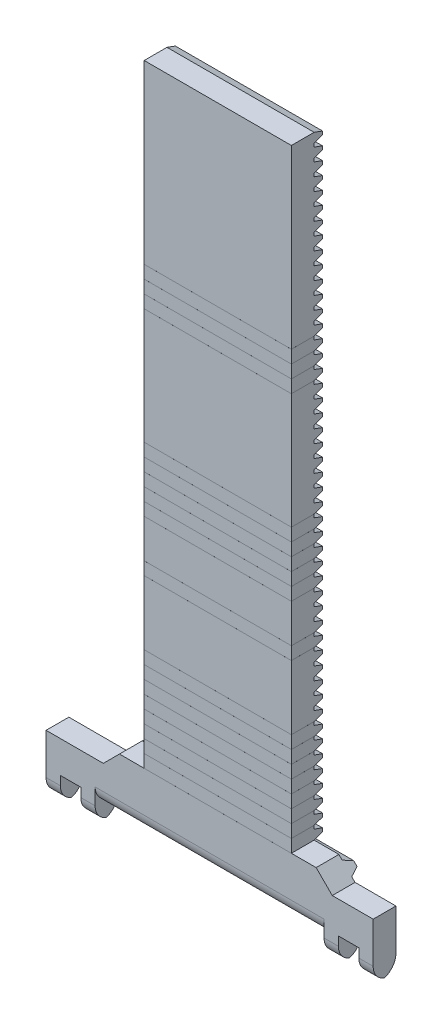
from build123d import *

# Parameters (mm, degrees)
BOSS_EXTRUDE1_DEPTH = 36
SCALE2_SCALE        = 0.5
SKETCH2_W           = 18
SKETCH2_H           = 20.0171228
BOSS_EXTRUDE2_DEPTH = 2
BOSS_EXTRUDE3_DEPTH = 18
SKETCH4_W           = 13.36957342
SKETCH4_H           = 20.007555445
CUT_EXTRUDE1_DEPTH  = 20
BOSS_EXTRUDE4_DEPTH = 5
CHAMFER1_SIZE       = 5
SKETCH6_W           = 6
SKETCH6_H           = 2.78539815
BOSS_EXTRUDE5_DEPTH = 2
FILLET2_R           = 2
SKETCH7_W           = 2.5
SKETCH7_H           = 3
CUT_EXTRUDE2_DEPTH  = 83.676186003


with BuildPart() as part:
    # Sketch1 → Boss-Extrude1 (new body)
    with BuildSketch(Plane(origin=(0, 0, 0), x_dir=(0, 0, -1), z_dir=(1, 0, 0))):
        Polygon((-1.05, -20.0171228), (1, -19.2709839), (1, -18.428128), (-1.05, -17.681989), (-1.05, -16.8755302), (1, -16.1293912), (1, -15.2865353), (-1.05, -14.5403964), (-1.05, -13.7339375), (1, -12.9877985), (1, -12.1449427), (-1.05, -11.3988037), (-1.05, -10.5923449), (1, -9.8462059), (1, -9.00335), (-1.05, -8.2572111), (-1.05, -7.4507522), (1, -6.7046132), (1, -5.8617574), (-1.05, -5.1156184), (-1.05, -4.3091596), (1, -3.5630206), (1, -2.7201647), (-1.05, -1.9740257), (-1.05, -1.1675669), (1, -0.4214279), (1, 0.4214279), (-1.05, 1.1675669), (-1.05, 1.9740257), (1, 2.7201647), (1, 3.5630206), (-1.05, 4.3091596), (-1.05, 5.1156184), (1, 5.8617574), (1, 6.7046132), (-1.05, 7.4507522), (-1.05, 8.2572111), (1, 9.00335), (1, 9.8462059), (-1.05, 10.5923449), (-1.05, 11.3988037), (1, 12.1449427), (1, 12.9877985), (-1.05, 13.7339375), (-1.05, 14.5403964), (1, 15.2865353), (1, 16.1293912), (-1.05, 16.8755302), (-1.05, 17.681989), (1, 18.428128), (1, 19.2709839), (-1.05, 20.0171228), (-2.6207963, 20.0171228), (-2.6207963, -20.0171228), align=None)
    extrude(amount=BOSS_EXTRUDE1_DEPTH)


with BuildPart() as part_1:
    # Scale2: scaled about (18, 0, 1.171434086)
    add(part.part.scale(SCALE2_SCALE).moved(Location((9, 0, 0.585717043))))

    # Sketch2 → Boss-Extrude2 (add)
    with BuildSketch(Plane.XY.offset(1.896115193)):
        with Locations((18, 0)):
            Rectangle(SKETCH2_W, SKETCH2_H)
    extrude(amount=BOSS_EXTRUDE2_DEPTH)

    # Sketch3 → Boss-Extrude3 (add)
    with BuildSketch(Plane.ZY.offset(-9)):
        Polygon((3.896115193, -11.577763191), (3.896115193, -10.0085614), (1.110717043, -10.0085614), (1.110717043, -10.410993545), (0.085717043, -10.784063045), (0.085717043, -11.205490995), (1.110717043, -11.578560445), (1.110717043, -11.577763191), align=None)
        Polygon((3.896115193, -13.147762236), (3.896115193, -11.578560445), (1.110717043, -11.578560445), (1.110717043, -11.980992591), (0.085717043, -12.354062091), (0.085717043, -12.775490041), (1.110717043, -13.148559491), (1.110717043, -13.147762236), align=None)
        Polygon((3.896115193, -14.717761281), (3.896115193, -13.148559491), (1.110717043, -13.148559491), (1.110717043, -13.550991636), (0.085717043, -13.924061136), (0.085717043, -14.345489086), (1.110717043, -14.718558536), (1.110717043, -14.717761281), align=None)
        Polygon((3.896115193, -16.287760327), (3.896115193, -14.718558536), (1.110717043, -14.718558536), (1.110717043, -15.120990681), (0.085717043, -15.494060181), (0.085717043, -15.915488131), (1.110717043, -16.288557581), (1.110717043, -16.287760327), align=None)
        Polygon((3.896115193, -16.288557581), (1.110717043, -16.288557581), (1.110717043, -16.690989727), (0.085717043, -17.064059227), (0.085717043, -17.485487177), (1.110717043, -17.858556627), (1.110717043, -18.260988772), (0.085717043, -18.634058272), (0.085717043, -19.055486222), (1.110717043, -19.428555672), (1.110717043, -19.830987818), (0.085717043, -20.204057318), (0.085717043, -20.625485268), (1.110717043, -20.998554718), (1.110717043, -21.400986863), (0.085717043, -21.774056363), (0.085717043, -22.195484313), (1.110717043, -22.568553763), (1.110717043, -22.970985908), (0.085717043, -23.344055408), (0.085717043, -23.765483358), (1.110717043, -24.138552808), (1.110717043, -24.540984954), (0.085717043, -24.914054454), (0.085717043, -25.335482404), (1.110717043, -25.708551854), (1.110717043, -26.110983999), (0.085717043, -26.484053499), (0.085717043, -26.905481449), (1.110717043, -27.278550899), (1.110717043, -27.680983044), (0.085717043, -28.054052544), (0.085717043, -28.475480494), (1.110717043, -28.848549944), (1.110717043, -29.25098209), (0.085717043, -29.62405159), (0.085717043, -30.04547954), (1.110717043, -30.41854899), (1.110717043, -30.417751735), (3.896115193, -30.417751735), align=None)
        Polygon((3.896115193, -31.98775078), (3.896115193, -30.41854899), (1.110717043, -30.41854899), (1.110717043, -30.820981135), (0.085717043, -31.194050635), (0.085717043, -31.615478585), (1.110717043, -31.988548035), (1.110717043, -31.98775078), align=None)
        Polygon((3.896115193, -33.557749826), (3.896115193, -31.988548035), (1.110717043, -31.988548035), (1.110717043, -32.39098018), (0.085717043, -32.76404968), (0.085717043, -33.18547763), (1.110717043, -33.55854708), (1.110717043, -33.557749826), align=None)
        Polygon((3.896115193, -35.127748871), (3.896115193, -33.55854708), (1.110717043, -33.55854708), (1.110717043, -33.960979226), (0.085717043, -34.334048726), (0.085717043, -34.755476676), (1.110717043, -35.128546126), (1.110717043, -35.127748871), align=None)
        Polygon((3.896115193, -36.697747916), (3.896115193, -35.128546126), (1.110717043, -35.128546126), (1.110717043, -35.530978271), (0.085717043, -35.904047771), (0.085717043, -36.325475721), (1.110717043, -36.698545171), (1.110717043, -36.697747916), align=None)
        Polygon((3.896115193, -38.267746962), (3.896115193, -36.698545171), (1.110717043, -36.698545171), (1.110717043, -37.100977316), (0.085717043, -37.474046816), (0.085717043, -37.895474766), (1.110717043, -38.268544216), (1.110717043, -38.267746962), align=None)
        Polygon((3.896115193, -38.268544216), (1.110717043, -38.268544216), (1.110717043, -38.670976362), (0.085717043, -39.044045862), (0.085717043, -39.465473812), (1.110717043, -39.838543262), (1.110717043, -40.240975407), (0.085717043, -40.614044907), (0.085717043, -41.035472857), (1.110717043, -41.408542307), (1.110717043, -41.810974453), (0.085717043, -42.184043953), (0.085717043, -42.605471903), (1.110717043, -42.978541353), (1.110717043, -42.977744098), (3.896115193, -42.977744098), align=None)
        Polygon((3.896115193, -44.547743143), (3.896115193, -42.978541353), (1.110717043, -42.978541353), (1.110717043, -43.380973498), (0.085717043, -43.754042998), (0.085717043, -44.175470948), (1.110717043, -44.548540398), (1.110717043, -44.547743143), align=None)
        Polygon((3.896115193, -44.548540398), (1.110717043, -44.548540398), (1.110717043, -44.950972543), (0.085717043, -45.324042043), (0.085717043, -45.745469993), (1.110717043, -46.118539443), (1.110717043, -46.520971589), (0.085717043, -46.894041089), (0.085717043, -47.315469039), (1.110717043, -47.688538489), (1.110717043, -48.090970634), (0.085717043, -48.464040134), (0.085717043, -48.885468084), (1.110717043, -49.258537534), (1.110717043, -49.660969679), (0.085717043, -50.034039179), (0.085717043, -50.455467129), (1.110717043, -50.828536579), (1.110717043, -51.230968725), (0.085717043, -51.604038225), (0.085717043, -52.025466175), (1.110717043, -52.398535625), (1.110717043, -52.39773837), (3.896115193, -52.39773837), align=None)
        Polygon((3.896115193, -53.967737415), (3.896115193, -52.398535625), (1.110717043, -52.398535625), (1.110717043, -52.80096777), (0.085717043, -53.17403727), (0.085717043, -53.59546522), (1.110717043, -53.96853467), (1.110717043, -53.967737415), align=None)
        Polygon((3.896115193, -55.537736461), (3.896115193, -53.96853467), (1.110717043, -53.96853467), (1.110717043, -54.370966815), (0.085717043, -54.744036315), (0.085717043, -55.165464265), (1.110717043, -55.538533715), (1.110717043, -55.537736461), align=None)
        Polygon((3.896115193, -57.107735506), (3.896115193, -55.538533715), (1.110717043, -55.538533715), (1.110717043, -55.940965861), (0.085717043, -56.314035361), (0.085717043, -56.735463311), (1.110717043, -57.108532761), (1.110717043, -57.107735506), align=None)
        Polygon((3.896115193, -58.677734552), (3.896115193, -57.108532761), (1.110717043, -57.108532761), (1.110717043, -57.510964906), (0.085717043, -57.884034406), (0.085717043, -58.305462356), (1.110717043, -58.678531806), (1.110717043, -58.677734552), align=None)
        Polygon((3.896115193, -60.247733597), (3.896115193, -58.678531806), (1.110717043, -58.678531806), (1.110717043, -59.080963952), (0.085717043, -59.454033452), (0.085717043, -59.875461402), (1.110717043, -60.248530852), (1.110717043, -60.247733597), align=None)
        Polygon((3.896115193, -61.817732642), (3.896115193, -60.248530852), (1.110717043, -60.248530852), (1.110717043, -60.650962997), (0.085717043, -61.024032497), (0.085717043, -61.445460447), (1.110717043, -61.818529897), (1.110717043, -61.817732642), align=None)
        Polygon((3.896115193, -63.387731688), (3.896115193, -61.818529897), (1.110717043, -61.818529897), (1.110717043, -62.220962042), (0.085717043, -62.594031542), (0.085717043, -63.015459492), (1.110717043, -63.388528942), (1.110717043, -63.387731688), align=None)
        Polygon((3.896115193, -64.957730733), (3.896115193, -63.388528942), (1.110717043, -63.388528942), (1.110717043, -63.790961088), (0.085717043, -64.164030588), (0.085717043, -64.585458538), (1.110717043, -64.958527988), (1.110717043, -64.957730733), align=None)
        Polygon((3.896115193, -64.958527988), (1.110717043, -64.958527988), (1.110717043, -65.360960133), (0.085717043, -65.734029633), (0.085717043, -66.155457583), (1.110717043, -66.528527033), (1.110717043, -66.930959178), (0.085717043, -67.304028678), (0.085717043, -67.725456628), (1.110717043, -68.098526078), (1.110717043, -68.500958224), (0.085717043, -68.874027724), (0.085717043, -69.295455674), (1.110717043, -69.668525124), (1.110717043, -69.667727869), (3.896115193, -69.667727869), align=None)
        Polygon((3.896115193, -71.237726914), (3.896115193, -69.668525124), (1.110717043, -69.668525124), (1.110717043, -70.070957269), (0.085717043, -70.444026769), (0.085717043, -70.865454719), (1.110717043, -71.238524169), (1.110717043, -71.237726914), align=None)
        Polygon((3.896115193, -72.80772596), (3.896115193, -71.238524169), (1.110717043, -71.238524169), (1.110717043, -71.640956314), (0.085717043, -72.014025814), (0.085717043, -72.435453764), (1.110717043, -72.808523214), (1.110717043, -72.80772596), align=None)
        Polygon((3.896115193, -72.808523214), (1.110717043, -72.808523214), (1.110717043, -73.21095536), (0.085717043, -73.58402486), (0.085717043, -74.00545281), (1.110717043, -74.37852226), (1.110717043, -74.780954405), (0.085717043, -75.154023905), (0.085717043, -75.575451855), (1.110717043, -75.948521305), (1.110717043, -76.350953451), (0.085717043, -76.724022951), (0.085717043, -77.145450901), (1.110717043, -77.518520351), (1.110717043, -77.517723096), (3.896115193, -77.517723096), align=None)
        Polygon((3.896115193, -79.087722141), (3.896115193, -77.518520351), (1.110717043, -77.518520351), (1.110717043, -77.920952496), (0.085717043, -78.294021996), (0.085717043, -78.715449946), (1.110717043, -79.088519396), (1.110717043, -79.087722141), align=None)
        Polygon((3.896115193, -80.657721187), (3.896115193, -79.088519396), (1.110717043, -79.088519396), (1.110717043, -79.490951541), (0.085717043, -79.864021041), (0.085717043, -80.285448991), (1.110717043, -80.658518441), (1.110717043, -80.657721187), align=None)
        Polygon((3.896115193, -82.227720232), (3.896115193, -80.658518441), (1.110717043, -80.658518441), (1.110717043, -81.060950587), (0.085717043, -81.434020087), (0.085717043, -81.855448037), (1.110717043, -82.228517487), (1.110717043, -82.227720232), align=None)
        Polygon((3.896115193, -83.797719277), (3.896115193, -82.228517487), (1.110717043, -82.228517487), (1.110717043, -82.630949632), (0.085717043, -83.004019132), (0.085717043, -83.425447082), (1.110717043, -83.798516532), (1.110717043, -83.797719277), align=None)
        Polygon((3.896115193, -85.367718323), (3.896115193, -83.798516532), (1.110717043, -83.798516532), (1.110717043, -84.200948677), (0.085717043, -84.574018177), (0.085717043, -84.995446127), (1.110717043, -85.368515577), (1.110717043, -85.367718323), align=None)
        Polygon((3.896115193, -86.938514623), (3.896115193, -85.368515577), (1.110717043, -85.368515577), (1.110717043, -85.770947723), (0.085717043, -86.144017223), (0.085717043, -86.565445173), (1.110717043, -86.938514623), align=None)
    extrude(amount=-BOSS_EXTRUDE3_DEPTH)

    # Sketch4 → Cut-Extrude1 (cut)
    with BuildSketch(Plane.ZY.offset(-9)):
        with Locations((-2.788671517, -76.934736901)):
            Rectangle(SKETCH4_W, SKETCH4_H)
    extrude(amount=-CUT_EXTRUDE1_DEPTH, mode=Mode.SUBTRACT)

    # Sketch5 → Boss-Extrude4 (add)
    with BuildSketch(Plane.XZ.offset(66.930959178)):
        Polygon((27, 1.110717043), (-3, 1.110717043), (-3, 3.896115193), (37, 3.896115193), (37, 1.110717043), align=None)
    extrude(amount=BOSS_EXTRUDE4_DEPTH)

    # Chamfer1
    # the kernel refuses this chamfer: 5 mm, written as the material it adds along each edge
    with BuildSketch(Plane(origin=(27, -66.930959178, 1.110717043), x_dir=(0.9996219169112968, -0.0274958766105877, 0), z_dir=(0, 0, 1))) as chamfer1_piece_1_section:
        Polygon((CHAMFER1_SIZE * 0.999621916911, CHAMFER1_SIZE * 0.0274958766106), (-CHAMFER1_SIZE * 0.0274958766106, CHAMFER1_SIZE * 0.999621916911), (0, 0), align=None)
    chamfer1_piece_1 = extrude(amount=2.78539815, mode=Mode.PRIVATE)
    chamfer1_piece_1 = split(chamfer1_piece_1, bisect_by=Plane(origin=(28.539384689, -65.21265417, 1.518184317), z_dir=(0, 0.9396926178756553, -0.3420201513215235)), keep=Keep.TOP, mode=Mode.PRIVATE)
    chamfer1_piece_1 = split(chamfer1_piece_1, bisect_by=Plane(origin=(28.539384689, -64.958527988, 1.475511473), z_dir=(0, -1, 0)), keep=Keep.TOP, mode=Mode.PRIVATE)
    add(chamfer1_piece_1)
    with BuildSketch(Plane(origin=(27, -66.930959178, -11.747697897), x_dir=(0.9996219169112968, -0.0274958766105877, 0), z_dir=(0, 0, 1))) as chamfer1_piece_2_section:
        Polygon((CHAMFER1_SIZE * 0.999621916911, CHAMFER1_SIZE * 0.0274958766106), (-CHAMFER1_SIZE * 0.0274958766106, CHAMFER1_SIZE * 0.999621916911), (0, 0), align=None)
    chamfer1_piece_2 = extrude(amount=15.64381309, mode=Mode.PRIVATE)
    chamfer1_piece_2 = split(chamfer1_piece_2, bisect_by=Plane(origin=(28.972728537, -65.960510872, 1.110717043), z_dir=(0, 0, -1)), keep=Keep.TOP, mode=Mode.PRIVATE)
    chamfer1_piece_2 = split(chamfer1_piece_2, bisect_by=Plane(origin=(28.972728537, -66.323155671, 0.546463803), z_dir=(0, 0.9396926326079168, 0.3420201108449659)), keep=Keep.TOP, mode=Mode.PRIVATE)
    chamfer1_piece_2 = split(chamfer1_piece_2, bisect_by=Plane(origin=(28.972728537, -65.960510872, 0.085717043), z_dir=(0, 0, 1)), keep=Keep.TOP, mode=Mode.PRIVATE)
    chamfer1_piece_2 = split(chamfer1_piece_2, bisect_by=Plane(origin=(28.972728537, -65.57002037, 0.536328778), z_dir=(0, -0.9396926178756553, 0.3420201513215235)), keep=Keep.TOP, mode=Mode.PRIVATE)
    add(chamfer1_piece_2)
    with BuildSketch(Plane(origin=(27, -66.930959178, 1.110717043), x_dir=(0.9996219169112968, -0.0274958766105877, 0), z_dir=(0, 0, 1))) as chamfer1_piece_3_section:
        Polygon((CHAMFER1_SIZE * 0.999621916911, CHAMFER1_SIZE * 0.0274958766106), (-CHAMFER1_SIZE * 0.0274958766106, CHAMFER1_SIZE * 0.999621916911), (0, 0), align=None)
    chamfer1_piece_3 = extrude(amount=2.78539815, mode=Mode.PRIVATE)
    chamfer1_piece_3 = split(chamfer1_piece_3, bisect_by=Plane(origin=(29.682450066, -66.728874494, 1.661167227), z_dir=(0, -0.9396926326079168, -0.3420201108449659)), keep=Keep.TOP, mode=Mode.PRIVATE)
    add(chamfer1_piece_3)
    with BuildSketch(Plane(origin=(27, -66.930959178, 1.110717043), x_dir=(0.9996219169112968, -0.0274958766105877, 0), z_dir=(0, 0, 1))) as chamfer1_piece_4_section:
        Polygon((CHAMFER1_SIZE * 0.999621916911, CHAMFER1_SIZE * 0.0274958766106), (-CHAMFER1_SIZE * 0.0274958766106, CHAMFER1_SIZE * 0.999621916911), (0, 0), align=None)
    chamfer1_piece_4 = extrude(amount=2.78539815, mode=Mode.PRIVATE)
    chamfer1_piece_4 = split(chamfer1_piece_4, bisect_by=Plane(origin=(29.039352716, -66.957811364, 2.290166176), z_dir=(0, 0.9396926326079168, 0.3420201108449659)), keep=Keep.TOP, mode=Mode.PRIVATE)
    chamfer1_piece_4 = split(chamfer1_piece_4, bisect_by=Plane(origin=(29.039352716, -64.958152892, 2.217420814), z_dir=(0, -0.9396926178756553, 0.3420201513215235)), keep=Keep.TOP, mode=Mode.PRIVATE)
    chamfer1_piece_4 = split(chamfer1_piece_4, bisect_by=Plane(origin=(29.039352716, -64.958527988, 2.617701564), z_dir=(0, -1, 0)), keep=Keep.TOP, mode=Mode.PRIVATE)
    add(chamfer1_piece_4)
    with BuildSketch(Plane(origin=(9, -66.930959178, 1.110717043), x_dir=(-0.9996219169112968, -0.0274958766105877, 0), z_dir=(0, 0, 1))) as chamfer1_piece_5_section:
        Polygon((CHAMFER1_SIZE * 0.999621916911, -CHAMFER1_SIZE * 0.0274958766106), (-CHAMFER1_SIZE * 0.0274958766106, -CHAMFER1_SIZE * 0.999621916911), (0, 0), align=None)
    chamfer1_piece_5 = extrude(amount=2.78539815, mode=Mode.PRIVATE)
    chamfer1_piece_5 = split(chamfer1_piece_5, bisect_by=Plane(origin=(7.460615311, -65.21265417, 1.518184317), z_dir=(0, 0.9396926178756553, -0.3420201513215235)), keep=Keep.TOP, mode=Mode.PRIVATE)
    chamfer1_piece_5 = split(chamfer1_piece_5, bisect_by=Plane(origin=(7.460615311, -64.958527988, 1.475511473), z_dir=(0, -1, 0)), keep=Keep.TOP, mode=Mode.PRIVATE)
    add(chamfer1_piece_5)
    with BuildSketch(Plane(origin=(9, -66.930959178, -11.747697897), x_dir=(-0.9996219169112968, -0.0274958766105877, 0), z_dir=(0, 0, 1))) as chamfer1_piece_6_section:
        Polygon((CHAMFER1_SIZE * 0.999621916911, -CHAMFER1_SIZE * 0.0274958766106), (-CHAMFER1_SIZE * 0.0274958766106, -CHAMFER1_SIZE * 0.999621916911), (0, 0), align=None)
    chamfer1_piece_6 = extrude(amount=15.64381309, mode=Mode.PRIVATE)
    chamfer1_piece_6 = split(chamfer1_piece_6, bisect_by=Plane(origin=(7.027271463, -65.960510872, 1.110717043), z_dir=(0, 0, -1)), keep=Keep.TOP, mode=Mode.PRIVATE)
    chamfer1_piece_6 = split(chamfer1_piece_6, bisect_by=Plane(origin=(7.027271463, -66.323155671, 0.546463803), z_dir=(0, 0.9396926326079168, 0.3420201108449659)), keep=Keep.TOP, mode=Mode.PRIVATE)
    chamfer1_piece_6 = split(chamfer1_piece_6, bisect_by=Plane(origin=(7.027271463, -65.960510872, 0.085717043), z_dir=(0, 0, 1)), keep=Keep.TOP, mode=Mode.PRIVATE)
    chamfer1_piece_6 = split(chamfer1_piece_6, bisect_by=Plane(origin=(7.027271463, -65.57002037, 0.536328778), z_dir=(0, -0.9396926178756553, 0.3420201513215235)), keep=Keep.TOP, mode=Mode.PRIVATE)
    add(chamfer1_piece_6)
    with BuildSketch(Plane(origin=(9, -66.930959178, 1.110717043), x_dir=(-0.9996219169112968, -0.0274958766105877, 0), z_dir=(0, 0, 1))) as chamfer1_piece_7_section:
        Polygon((CHAMFER1_SIZE * 0.999621916911, -CHAMFER1_SIZE * 0.0274958766106), (-CHAMFER1_SIZE * 0.0274958766106, -CHAMFER1_SIZE * 0.999621916911), (0, 0), align=None)
    chamfer1_piece_7 = extrude(amount=2.78539815, mode=Mode.PRIVATE)
    chamfer1_piece_7 = split(chamfer1_piece_7, bisect_by=Plane(origin=(6.317549934, -66.728874494, 1.661167227), z_dir=(0, -0.9396926326079168, -0.3420201108449659)), keep=Keep.TOP, mode=Mode.PRIVATE)
    add(chamfer1_piece_7)
    with BuildSketch(Plane(origin=(9, -66.930959178, 1.110717043), x_dir=(-0.9996219169112968, -0.0274958766105877, 0), z_dir=(0, 0, 1))) as chamfer1_piece_8_section:
        Polygon((CHAMFER1_SIZE * 0.999621916911, -CHAMFER1_SIZE * 0.0274958766106), (-CHAMFER1_SIZE * 0.0274958766106, -CHAMFER1_SIZE * 0.999621916911), (0, 0), align=None)
    chamfer1_piece_8 = extrude(amount=2.78539815, mode=Mode.PRIVATE)
    chamfer1_piece_8 = split(chamfer1_piece_8, bisect_by=Plane(origin=(6.960647284, -66.957811364, 2.290166176), z_dir=(0, 0.9396926326079168, 0.3420201108449659)), keep=Keep.TOP, mode=Mode.PRIVATE)
    chamfer1_piece_8 = split(chamfer1_piece_8, bisect_by=Plane(origin=(6.960647284, -64.958152892, 2.217420814), z_dir=(0, -0.9396926178756553, 0.3420201513215235)), keep=Keep.TOP, mode=Mode.PRIVATE)
    chamfer1_piece_8 = split(chamfer1_piece_8, bisect_by=Plane(origin=(6.960647284, -64.958527988, 2.617701564), z_dir=(0, -1, 0)), keep=Keep.TOP, mode=Mode.PRIVATE)
    add(chamfer1_piece_8)

    # Sketch6 → Boss-Extrude5 (add)
    with BuildSketch(Plane.XZ.offset(71.930959178)):
        with Locations((0, 2.503416118)):
            Rectangle(SKETCH6_W, SKETCH6_H)
        with Locations((34, 2.503416118)):
            Rectangle(SKETCH6_W, SKETCH6_H)
    extrude(amount=BOSS_EXTRUDE5_DEPTH)

    # Fillet2
    # the kernel refuses this fillet: 2 mm, written as the material it takes off along each edge
    with BuildSketch(Plane(origin=(42, -73.930959178, 1.110717043), x_dir=(0, 0, 1), z_dir=(-1, 0, 0)), Plane(origin=(8, -73.930959178, 3.896115193), x_dir=(0, 1, 0), z_dir=(-1, 0, 0))) as fillet2_piece_1:
        with BuildLine():
            CenterArc((FILLET2_R, FILLET2_R), FILLET2_R, 180, 90)
            Line((0, FILLET2_R), (0, 0))
            Line((0, 0), (FILLET2_R, 0))
        make_face()
    extrude(amount=16, mode=Mode.SUBTRACT)
    with BuildSketch(Plane(origin=(26, -73.930959178, 3.896115193), x_dir=(0, 1, 0), z_dir=(1, 0, 0)), Plane(origin=(-8, -73.930959178, 1.110717043), x_dir=(0, 0, 1), z_dir=(1, 0, 0))) as fillet2_piece_2:
        with BuildLine():
            CenterArc((FILLET2_R, -FILLET2_R), FILLET2_R, 90, 90)
            Line((0, -FILLET2_R), (0, 0))
            Line((0, 0), (FILLET2_R, 0))
        make_face()
    extrude(amount=16, mode=Mode.SUBTRACT)
    with BuildSketch(Plane(origin=(3, -71.930959178, 3.896115193), x_dir=(0, 1, 0), z_dir=(1, 0, 0))) as fillet2_piece_3:
        with BuildLine():
            CenterArc((FILLET2_R, -FILLET2_R), FILLET2_R, 90, 90)
            Line((0, -FILLET2_R), (0, 0))
            Line((0, 0), (FILLET2_R, 0))
        make_face()
    extrude(amount=28, mode=Mode.SUBTRACT)
    with BuildSketch(Plane(origin=(31, -71.930959178, 1.110717043), x_dir=(0, 0, 1), z_dir=(-1, 0, 0))) as fillet2_piece_4:
        with BuildLine():
            CenterArc((FILLET2_R, FILLET2_R), FILLET2_R, 180, 90)
            Line((0, FILLET2_R), (0, 0))
            Line((0, 0), (FILLET2_R, 0))
        make_face()
    extrude(amount=28, mode=Mode.SUBTRACT)

    # Sketch7 → Cut-Extrude2 (cut, through all)
    with BuildSketch(Plane.XY.offset(3.896115193)):
        with Locations((34, -72.336526177)):
            Rectangle(SKETCH7_W, SKETCH7_H)
        with Locations((0, -72.336526177)):
            Rectangle(SKETCH7_W, SKETCH7_H)
    extrude(amount=-CUT_EXTRUDE2_DEPTH, mode=Mode.SUBTRACT)


solid = part_1.part
